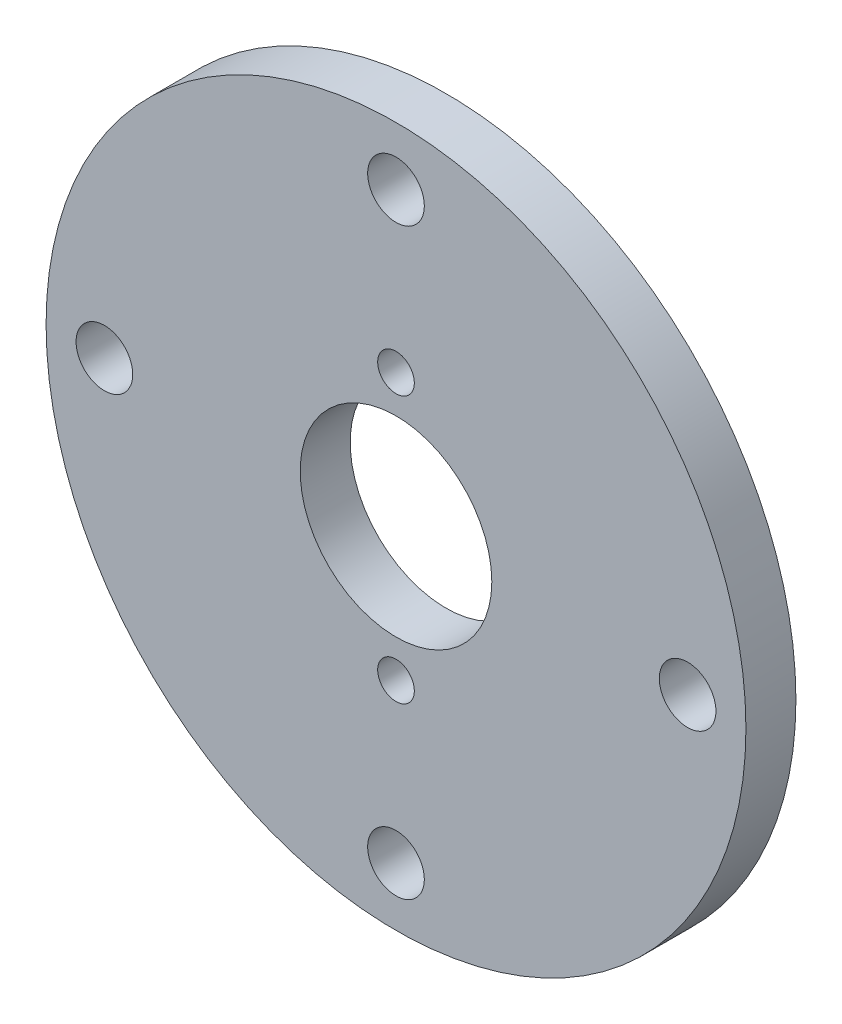
from build123d import *

# Parameters (mm, degrees)
SKETCH1_R           = 21
SKETCH1_R_2         = 1.1
SKETCH1_R_3         = 5.75
SKETCH1_R_4         = 1.7
BOSS_EXTRUDE1_DEPTH = 3


with BuildPart() as part:
    # Sketch1 → Boss-Extrude1 (new body)
    with BuildSketch(Plane.XY):
        Circle(SKETCH1_R)
        with Locations((0, -8)):
            Circle(SKETCH1_R_2, mode=Mode.SUBTRACT)
        Circle(SKETCH1_R_3, mode=Mode.SUBTRACT)
        with Locations((0, 8)):
            Circle(SKETCH1_R_2, mode=Mode.SUBTRACT)
        with Locations((0, -17.5)):
            Circle(SKETCH1_R_4, mode=Mode.SUBTRACT)
        with Locations((-17.5, 0)):
            Circle(SKETCH1_R_4, mode=Mode.SUBTRACT)
        with Locations((0, 17.5)):
            Circle(SKETCH1_R_4, mode=Mode.SUBTRACT)
        with Locations((17.5, 0)):
            Circle(SKETCH1_R_4, mode=Mode.SUBTRACT)
    extrude(amount=BOSS_EXTRUDE1_DEPTH)


solid = part.part
